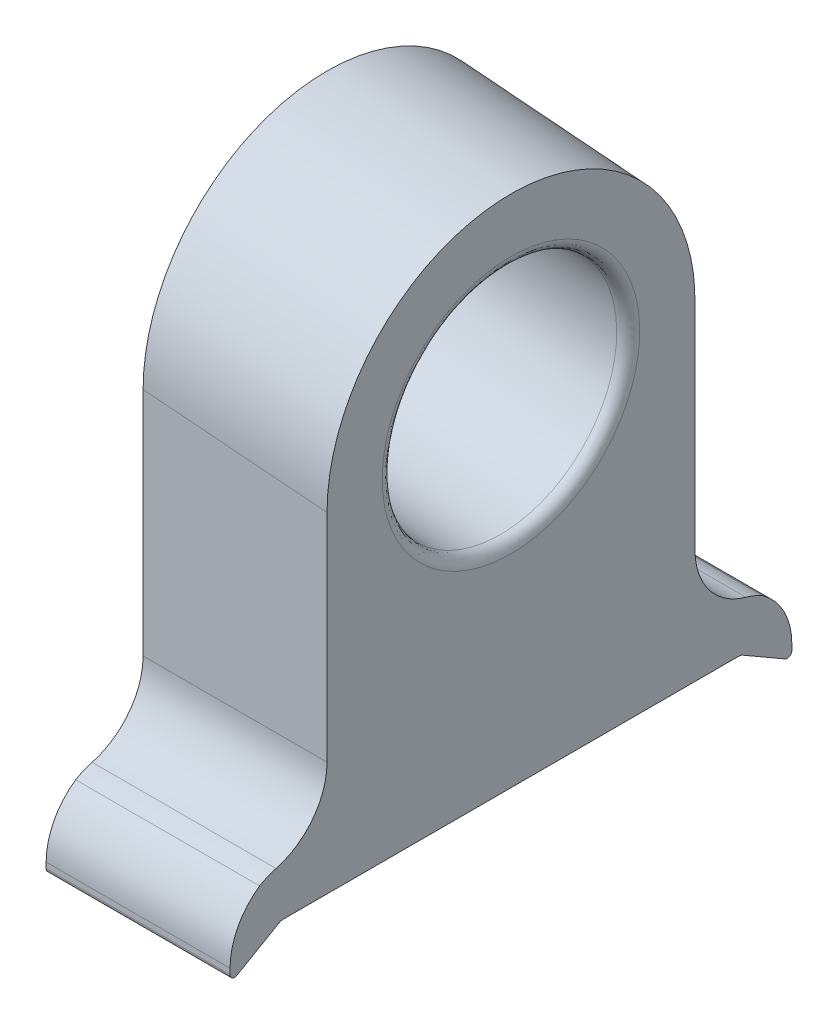
from build123d import *

# Parameters (mm, degrees)
BOSS_EXTRUDE1_DEPTH = 25
SKETCH3_R           = 5.1
CUT_EXTRUDE1_DEPTH  = 25
CUT_EXTRUDE2_DEPTH  = 25
FILLET1_R           = 0.5
BOSS_EXTRUDE3_DEPTH = 8
FILLET2_R           = 0.4
CUT_EXTRUDE3_DEPTH  = 8
FILLET4_R           = 3
FILLET5_R           = 3
FILLET6_R           = 3
FILLET7_R           = 0.2


with BuildPart() as part:
    # Sketch2 → Boss-Extrude1 (new body)
    with BuildSketch(Plane(origin=(0, 0, 0), x_dir=(1, 0, 0), z_dir=(0, 1, 0))):
        Polygon((0, 0), (0, -8), (8, -8), (8, 8), (0, 8), align=None)
    extrude(amount=BOSS_EXTRUDE1_DEPTH)

    # Sketch3 → Cut-Extrude1 (cut, along a direction that is not the sketch's normal)
    with BuildSketch(Plane(origin=(0, 0, 0), x_dir=(0, 0, -1), z_dir=(1, 0, 0))):
        with Locations((0, 15)):
            Circle(SKETCH3_R)
    extrude(amount=CUT_EXTRUDE1_DEPTH, dir=(0.9969173337331277, -0.07845909572784854, 0), mode=Mode.SUBTRACT)

    # Sketch4 → Cut-Extrude2 (cut, along a direction that is not the sketch's normal)
    with BuildSketch(Plane(origin=(0, 0, 0), x_dir=(0, 0, -1), z_dir=(1, 0, 0))):
        with BuildLine():
            Line((8, 15), (9.875195186, 15))
            Line((9.875195186, 15), (9.875195186, 26.385867588))
            Line((9.875195186, 26.385867588), (-10.505754032, 26.385867588))
            Line((-10.505754032, 26.385867588), (-10.505754032, 15))
            Line((-10.505754032, 15), (-8, 15))
            ThreePointArc((-8, 15), (0, 23), (8, 15))
        make_face()
    extrude(amount=CUT_EXTRUDE2_DEPTH, dir=(0.9969173337331277, -0.07845909572784854, 0), mode=Mode.SUBTRACT)

    # Fillet1
    fillet1_edges = [part.edges().sort_by_distance(p)[0] for p in [
        (0, 15, 5.1),
        (8, 14.370386346, 5.100000071),
    ]]
    fillet(fillet1_edges, radius=FILLET1_R)

    # Sketch5 → Boss-Extrude3 (add)
    with BuildSketch(Plane(origin=(0, 0, 0), x_dir=(0, 0, -1), z_dir=(1, 0, 0))):
        Polygon((10.535898385, 2), (-10.535898385, 2), (-16.21745197, -1.280246492), (-12.21745197, -1.280246492), (-10, 0), (10, 0), (12.21745197, -1.280246492), (16.21745197, -1.280246492), align=None)
    extrude(amount=BOSS_EXTRUDE3_DEPTH)

    # Fillet2
    fillet2_edges = [part.edges().sort_by_distance(p)[0] for p in [
        (4, 0, 10),
        (4, 0, -10),
    ]]
    fillet(fillet2_edges, radius=FILLET2_R)

    # Sketch6 → Cut-Extrude3 (cut)
    with BuildSketch(Plane(origin=(0, 0, 0), x_dir=(0, 0, -1), z_dir=(1, 0, 0))):
        Polygon((-12.21745197, -1.280246492), (-12.21745197, 1.727389059), (-17.377022548, 1.727389059), (-17.377022548, -2.102656652), (-12.21745197, -2.102656652), align=None)
        Polygon((12.21745197, -1.280246492), (12.21745197, 2.73049627), (17.312248613, 2.73049627), (17.312248613, -3.616436624), (12.21745197, -3.616436624), align=None)
    extrude(amount=CUT_EXTRUDE3_DEPTH, mode=Mode.SUBTRACT)

    # Fillet4
    # the kernel refuses this fillet: 3 mm, written as the material it adds along each edge
    with BuildSketch(Plane(origin=(8, 2, 8), x_dir=(0, 0, 1), z_dir=(-1, 0, 0))) as fillet4_piece_1:
        with BuildLine():
            CenterArc((3, 2.963884224), FILLET4_R, 180, 81.10057112)
            Line((0, 2.963884224), (-0.06, 2.963884224))
            Line((-0.06, 2.963884224), (-0.06, 0))
            Line((-0.06, 0), (0, -0.06))
            ThreePointArc((0, -0.06), (1.267949192, -0.06), (2.526616353, -0.059277684))
            Line((2.526616353, -0.059277684), (2.535898385, 0))
        make_face()
    extrude(amount=8)
    with BuildSketch(Plane(origin=(0, 2, -8), x_dir=(0, 1, 0), z_dir=(1, 0, 0))) as fillet4_piece_2:
        with BuildLine():
            CenterArc((2.963884224, -3), FILLET4_R, 90, 81.10057112)
            Line((0, -2.535898385), (-0.059277684, -2.526616353))
            ThreePointArc((-0.059277684, -2.526616353), (-0.06, -1.267949192), (-0.06, 0))
            Line((-0.06, 0), (0, 0.06))
            Line((0, 0.06), (2.963884224, 0.06))
            Line((2.963884224, 0.06), (2.963884224, 0))
        make_face()
    extrude(amount=8)

    # Fillet5
    fillet5_edges = [part.edges().sort_by_distance(p)[0] for p in [
        (4, 2, -10.535898385),
        (4, 2, 10.535898385),
    ]]
    fillet(fillet5_edges, radius=FILLET5_R)

    # Fillet6
    # the kernel refuses this fillet: 3 mm, written as the material it takes off along each edge
    with BuildSketch(Plane(origin=(12.298219074, 1.029154585, 12.21745197), x_dir=(0, 0.4999999999963209, -0.8660254037865628), z_dir=(-1, 0, 0))) as fillet6_piece_1:
        with BuildLine():
            CenterArc((1.738432397, 2.988946764), FILLET6_R, 210, 55.080112575)
            Line((-0.859643815, 1.488946764), (-0.911605339, 1.458946764))
            Line((-0.911605339, 1.458946764), (-0.051961524, -0.03))
            Line((-0.051961524, -0.03), (0, -0.06))
            ThreePointArc((0, -0.06), (0.740572073, -0.06), (1.47599838, -0.059778935))
            Line((1.47599838, -0.059778935), (1.481144145, 0))
        make_face()
    extrude(amount=16.596438148, mode=Mode.SUBTRACT)
    with BuildSketch(Plane(origin=(12.298219074, 1.029154585, -12.21745197), x_dir=(0, 0.4999999999963147, 0.8660254037865663), z_dir=(-1, 0, 0))) as fillet6_piece_2:
        with BuildLine():
            CenterArc((1.738432397, -2.988946764), FILLET6_R, 94.919887425, 55.080112575)
            Line((-0.859643815, -1.488946764), (-0.911605339, -1.458946764))
            Line((-0.911605339, -1.458946764), (-0.051961524, 0.03))
            Line((-0.051961524, 0.03), (0, 0.06))
            ThreePointArc((0, 0.06), (0.740572073, 0.06), (1.47599838, 0.059778935))
            Line((1.47599838, 0.059778935), (1.481144145, 0))
        make_face()
    extrude(amount=16.596438148, mode=Mode.SUBTRACT)

    # Fillet7
    fillet7_edges = [part.edges().sort_by_distance(p)[0] for p in [
        (4, -1.280246492, 12.21745197),
        (4, -1.280246492, -12.21745197),
    ]]
    fillet(fillet7_edges, radius=FILLET7_R)


solid = part.part
